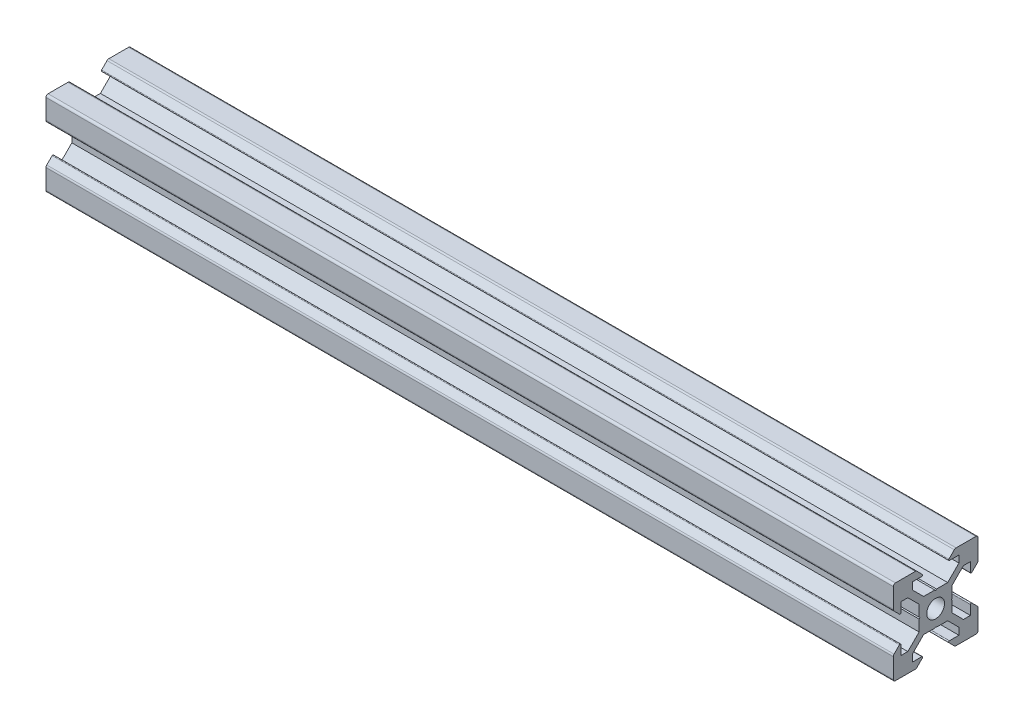
from build123d import *

# Parameters (mm, degrees)
BOSS_EXTRUDE1_DEPTH = 100
CIRPATTERN1_COUNT   = 4


# Read off the part's stored shape, not the designer's step: M5 Tapped Hole1
with BuildPart() as part:
    # Sketch1 → Boss-Extrude1 (new, symmetric)
    with BuildSketch(Plane(origin=(0, 0, 0), x_dir=(0, 0, -1), z_dir=(1, 0, 0))):
        with BuildLine():
            Line((0, 2), (0, 3.7))
            Line((0, 3.7), (-0.2, 3.9))
            Line((-0.2, 3.9), (-2.839339827, 3.9))
            Line((-2.839339827, 3.9), (-5.5, 6.560660173))
            Line((-5.5, 6.560660173), (-5.5, 8.2))
            Line((-5.5, 8.2), (-3.262842712, 8.2))
            ThreePointArc((-3.262842712, 8.2), (-3.078066806, 8.323463314), (-3.121421356, 8.541421356))
            Line((-3.121421356, 8.541421356), (-4.401335137, 9.821335137))
            ThreePointArc((-4.401335137, 9.821335137), (-4.599233379, 9.953566515), (-4.832670273, 10))
            Line((-4.832670273, 10), (-9.5, 10))
            ThreePointArc((-9.5, 10), (-9.853553391, 9.853553391), (-10, 9.5))
            Line((-10, 9.5), (-10, 4.832670273))
            ThreePointArc((-10, 4.832670273), (-9.953566515, 4.599233379), (-9.821335137, 4.401335137))
            Line((-9.821335137, 4.401335137), (-8.541421356, 3.121421356))
            ThreePointArc((-8.541421356, 3.121421356), (-8.323463314, 3.078066806), (-8.2, 3.262842712))
            Line((-8.2, 3.262842712), (-8.2, 5.5))
            Line((-8.2, 5.5), (-6.560660173, 5.5))
            Line((-6.560660173, 5.5), (-3.9, 2.839339827))
            Line((-3.9, 2.839339827), (-3.9, 0.2))
            Line((-3.9, 0.2), (-3.7, 0))
            Line((-3.7, 0), (-2, 0))
            ThreePointArc((-2, 0), (-1.414213562, 1.414213562), (0, 2))
        make_face()
    boss_extrude1 = extrude(amount=BOSS_EXTRUDE1_DEPTH, both=True)

    # CirPattern1: Boss-Extrude1 ×4 about axis
    cirpattern1_axis = Axis((0, 0, 0), (1, 0, 0))
    for i in range(1, CIRPATTERN1_COUNT):
        add(boss_extrude1.rotate(cirpattern1_axis, i * 360 / CIRPATTERN1_COUNT))

    # M5 Tapped Hole1 outline → M5 Tapped Hole1 (revolve, cut)
    with BuildSketch(Plane.YX):
        Polygon((2.1, -87.6), (2, -87.539913938), (2, -100), (2.1, -100), align=None)
        Polygon((2, 100), (2, 87.539913938), (2.1, 87.6), (2.1, 100), align=None)
    revolve(axis=Axis((0, 0, 0), (1, 0, 0)), mode=Mode.SUBTRACT)


solid = part.part
